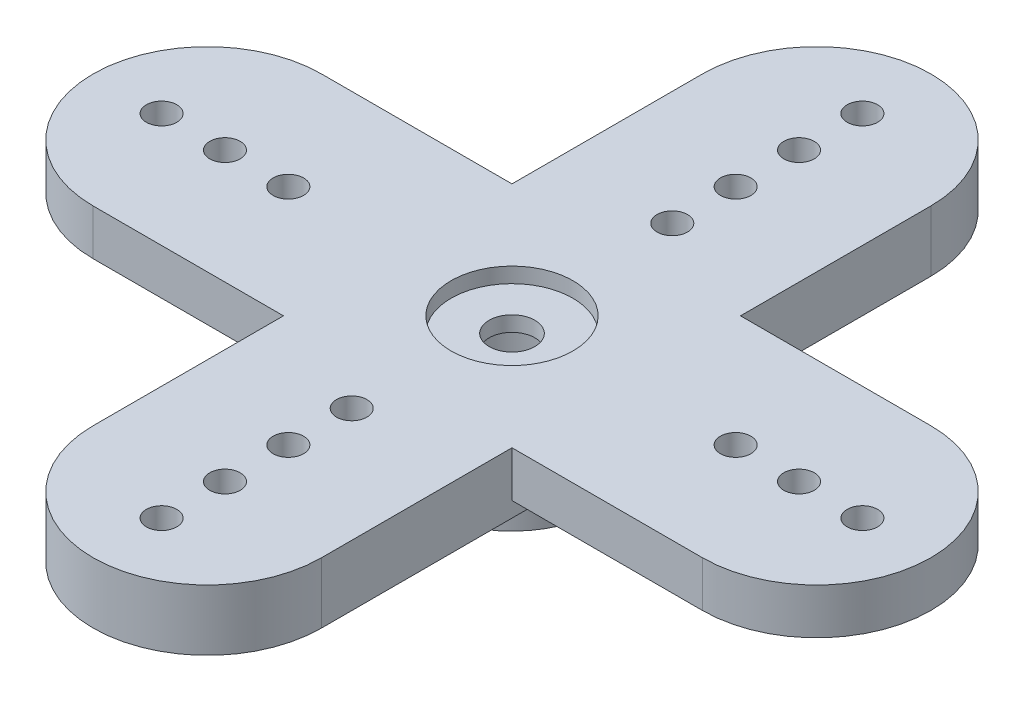
from build123d import *

# Parameters (mm, degrees)
SKETCH1_R           = 0.79375
SKETCH1_R_2         = 1.190625
BOSS_EXTRUDE1_DEPTH = 3.175
CUT_EXTRUDE1_DEPTH  = 0.79375
SKETCH4_R           = 3.175
CUT_EXTRUDE2_DEPTH  = 0.79375
SKETCH5_R           = 4.7625
SKETCH5_R_2         = 3.048
BOSS_EXTRUDE2_DEPTH = 3.175
CUT_EXTRUDE3_START  = -1.5875
SKETCH6_R           = 3.048
CUT_EXTRUDE3_DEPTH  = 1.5875


with BuildPart() as part:
    # Sketch1 → Boss-Extrude1 (new body)
    with BuildSketch(Plane(origin=(0, 0, 0), x_dir=(1, 0, 0), z_dir=(0, 1, 0))):
        with BuildLine():
            Line((5.953125, 15.875), (5.953125, 5.952125))
            Line((5.953125, 5.952125), (15.876, 5.952125))
            ThreePointArc((15.876, 5.952125), (21.829125, -0.001), (15.876, -5.954125))
            Line((15.876, -5.954125), (5.953125, -5.954125))
            Line((5.953125, -5.954125), (5.953125, -15.875))
            ThreePointArc((5.953125, -15.875), (0, -21.828125), (-5.953125, -15.875))
            Line((-5.953125, -15.875), (-5.953125, -5.954125))
            Line((-5.953125, -5.954125), (-15.874, -5.954125))
            ThreePointArc((-15.874, -5.954125), (-21.827125, -0.001), (-15.874, 5.952125))
            Line((-15.874, 5.952125), (-5.953125, 5.952125))
            Line((-5.953125, 5.952125), (-5.953125, 15.875))
            ThreePointArc((-5.953125, 15.875), (0, 21.828125), (5.953125, 15.875))
        make_face()
        with Locations((-18.25625, 0)):
            Circle(SKETCH1_R, mode=Mode.SUBTRACT)
        with Locations((0, 18.25625)):
            Circle(SKETCH1_R, mode=Mode.SUBTRACT)
        with Locations((18.25625, 0)):
            Circle(SKETCH1_R, mode=Mode.SUBTRACT)
        with Locations((0, -18.25625)):
            Circle(SKETCH1_R, mode=Mode.SUBTRACT)
        Circle(SKETCH1_R_2, mode=Mode.SUBTRACT)
        with Locations((0, 14.95425)):
            Circle(SKETCH1_R, mode=Mode.SUBTRACT)
        with Locations((0, 11.65225)):
            Circle(SKETCH1_R, mode=Mode.SUBTRACT)
        with Locations((14.95425, 0)):
            Circle(SKETCH1_R, mode=Mode.SUBTRACT)
        with Locations((11.65225, 0)):
            Circle(SKETCH1_R, mode=Mode.SUBTRACT)
        with Locations((0, -14.95425)):
            Circle(SKETCH1_R, mode=Mode.SUBTRACT)
        with Locations((0, -11.65225)):
            Circle(SKETCH1_R, mode=Mode.SUBTRACT)
        with Locations((-14.95425, 0)):
            Circle(SKETCH1_R, mode=Mode.SUBTRACT)
        with Locations((-11.65225, 0)):
            Circle(SKETCH1_R, mode=Mode.SUBTRACT)
        with Locations((0, 8.35025)):
            Circle(SKETCH1_R, mode=Mode.SUBTRACT)
        with Locations((0, -8.35025)):
            Circle(SKETCH1_R, mode=Mode.SUBTRACT)
    extrude(amount=BOSS_EXTRUDE1_DEPTH)

    # Sketch3 → Cut-Extrude1 (cut)
    with BuildSketch(Plane.XZ):
        with BuildLine():
            Line((5.953125, -5.952125), (5.953125, 5.954125))
            Line((5.953125, 5.954125), (15.876, 5.954125))
            ThreePointArc((15.876, 5.954125), (21.829125, 0.001), (15.876, -5.952125))
            Line((15.876, -5.952125), (5.953125, -5.952125))
        make_face()
        with BuildLine():
            Line((-15.876, 5.954125), (-5.953125, 5.954125))
            Line((-5.953125, 5.954125), (-5.953125, -5.952125))
            Line((-5.953125, -5.952125), (-15.876, -5.952125))
            ThreePointArc((-15.876, -5.952125), (-21.829125, 0.001), (-15.876, 5.954125))
        make_face()
    extrude(amount=-CUT_EXTRUDE1_DEPTH, mode=Mode.SUBTRACT)

    # Sketch4 → Cut-Extrude2 (cut)
    with BuildSketch(Plane(origin=(0, 3.175, 0), x_dir=(1, 0, 0), z_dir=(0, 1, 0))):
        Circle(SKETCH4_R)
    extrude(amount=-CUT_EXTRUDE2_DEPTH, mode=Mode.SUBTRACT)

    # Sketch5 → Boss-Extrude2 (add)
    with BuildSketch(Plane.XZ):
        Circle(SKETCH5_R)
        Circle(SKETCH5_R_2, mode=Mode.SUBTRACT)
    extrude(amount=BOSS_EXTRUDE2_DEPTH)

    # Sketch6 → Cut-Extrude3 (cut)
    with BuildSketch(Plane.XZ.offset(CUT_EXTRUDE3_START)):
        Circle(SKETCH6_R)
    extrude(amount=CUT_EXTRUDE3_DEPTH, mode=Mode.SUBTRACT)


solid = part.part
